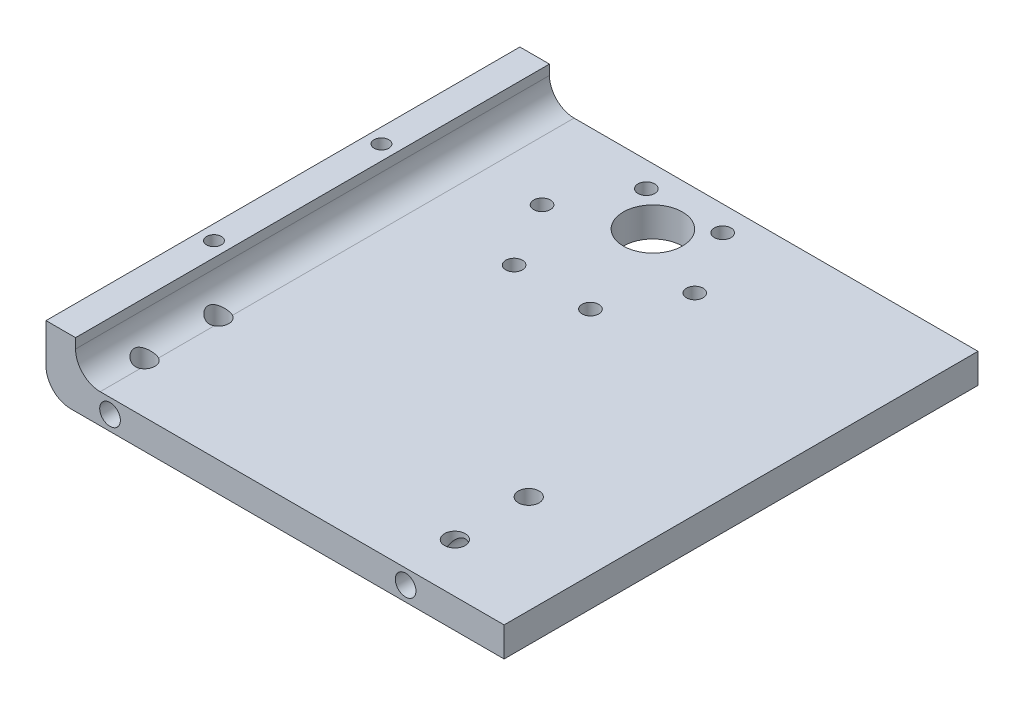
from build123d import *

# Parameters (mm, degrees)
SKETCH1_W           = 93
SKETCH1_H           = 96.2019
SKETCH1_R           = 6
SKETCH1_R_2         = 1.7
SKETCH1_R_3         = 2.1
BOSS_EXTRUDE1_DEPTH = 6
BOSS_EXTRUDE2_START = -6
SKETCH2_W           = 6
SKETCH2_H           = 96.2019
SKETCH2_R           = 1.5
BOSS_EXTRUDE2_DEPTH = 7
SKETCH2_3_R         = 1.5
CUT_EXTRUDE2_DEPTH  = 135.435135153
SKETCH3_R           = 2.1
CUT_EXTRUDE3_DEPTH  = 18
CUT_EXTRUDE4_START  = -78.2019
SKETCH3_2_R         = 2.1
CUT_EXTRUDE4_DEPTH  = 18
FILLET1_R           = 5


with BuildPart() as part:
    # Sketch1 → Boss-Extrude1 (new body)
    with BuildSketch(Plane(origin=(0, 0, 0), x_dir=(-1, 0, 0), z_dir=(0, 1, 0))):
        with Locations((46.5, 48.10095)):
            Rectangle(SKETCH1_W, SKETCH1_H)
        with Locations(Location((54.5, 11.5, 0), (0, 0, 90))):
            Circle(SKETCH1_R, mode=Mode.SUBTRACT)
        with Locations(Location((39, 18.5, 0), (0, 0, 90))):
            Circle(SKETCH1_R_2, mode=Mode.SUBTRACT)
        with Locations(Location((46.75, 31.923393759, 0), (0, 0, 90))):
            Circle(SKETCH1_R_2, mode=Mode.SUBTRACT)
        with Locations(Location((62.25, 31.923393759, 0), (0, 0, 90))):
            Circle(SKETCH1_R_2, mode=Mode.SUBTRACT)
        with Locations(Location((70, 18.5, 0), (0, 0, 90))):
            Circle(SKETCH1_R_2, mode=Mode.SUBTRACT)
        with Locations(Location((62.25, 5.076606241, 0), (0, 0, 90))):
            Circle(SKETCH1_R_2, mode=Mode.SUBTRACT)
        with Locations(Location((46.75, 5.076606241, 0), (0, 0, 90))):
            Circle(SKETCH1_R_2, mode=Mode.SUBTRACT)
        with Locations(Location((20, 86.2019, 0), (0, 0, 90))):
            Circle(SKETCH1_R_3, mode=Mode.SUBTRACT)
        with Locations(Location((83, 86.2019, 0), (0, 0, 90))):
            Circle(SKETCH1_R_3, mode=Mode.SUBTRACT)
        with Locations(Location((83, 71.2019, 0), (0, 0, 90))):
            Circle(SKETCH1_R_3, mode=Mode.SUBTRACT)
        with Locations(Location((20, 71.2019, 0), (0, 0, 90))):
            Circle(SKETCH1_R_3, mode=Mode.SUBTRACT)
    extrude(amount=BOSS_EXTRUDE1_DEPTH)

    # Sketch2 → Boss-Extrude2 (add)
    with BuildSketch(Plane(origin=(0, 0, 0), x_dir=(-1, 0, 0), z_dir=(0, -1, 0)).offset(BOSS_EXTRUDE2_START)):
        with Locations((90, -48.10095)):
            Rectangle(SKETCH2_W, SKETCH2_H)
        with Locations(Location((90, -65.10095, 0), (0, 0, 90))):
            Circle(SKETCH2_R, mode=Mode.SUBTRACT)
        with Locations(Location((90, -31.10095, 0), (0, 0, 90))):
            Circle(SKETCH2_R, mode=Mode.SUBTRACT)
    extrude(amount=-BOSS_EXTRUDE2_DEPTH)

    # Sketch2<3> → Cut-Extrude2 (cut, through all)
    with BuildSketch(Plane(origin=(0, 0, 0), x_dir=(-1, 0, 0), z_dir=(0, -1, 0))):
        with Locations(Location((90, -31.10095, 0), (0, 0, 90))):
            Circle(SKETCH2_3_R)
        with Locations(Location((90, -65.10095, 0), (0, 0, 90))):
            Circle(SKETCH2_3_R)
    extrude(amount=-CUT_EXTRUDE2_DEPTH, mode=Mode.SUBTRACT)

    # Sketch3 → Cut-Extrude3 (cut)
    with BuildSketch(Plane(origin=(0, 0, 0), x_dir=(1, 0, 0), z_dir=(0, 0, -1))):
        with Locations(Location((-80, -3, 0), (0, 0, 180))):
            Circle(SKETCH3_R)
        with Locations(Location((-20, -3, 0), (0, 0, 180))):
            Circle(SKETCH3_R)
    extrude(amount=-CUT_EXTRUDE3_DEPTH, mode=Mode.SUBTRACT)

    # Sketch3<2> → Cut-Extrude4 (cut)
    with BuildSketch(Plane(origin=(0, 0, 0), x_dir=(1, 0, 0), z_dir=(0, 0, -1)).offset(CUT_EXTRUDE4_START)):
        with Locations(Location((-80, -3, 0), (0, 0, 180))):
            Circle(SKETCH3_2_R)
        with Locations(Location((-20, -3, 0), (0, 0, 180))):
            Circle(SKETCH3_2_R)
    extrude(amount=-CUT_EXTRUDE4_DEPTH, mode=Mode.SUBTRACT)

    # Fillet1
    # the kernel refuses this fillet: 5 mm, written as the material it adds along each edge
    with BuildSketch(Plane(origin=(-87, 6, 96.2019), x_dir=(1, 0, 0), z_dir=(0, 0, -1))) as fillet1_piece_1_section:
        with BuildLine():
            CenterArc((FILLET1_R, -FILLET1_R), FILLET1_R, 90, 90)
            Line((0, -FILLET1_R), (0, 0))
            Line((0, 0), (FILLET1_R, 0))
        make_face()
    fillet1_piece_1 = extrude(amount=96.2019, mode=Mode.PRIVATE)
    fillet1_piece_1 = fillet1_piece_1 - Plane(origin=(-83, 7.144811059, 71.2019), x_dir=(0, 0, 1), z_dir=(0, -1, 0)) * Cylinder(2.1, 213, mode=Mode.PRIVATE)
    fillet1_piece_1 = fillet1_piece_1 - Plane(origin=(-83, 7.144811059, 86.2019), x_dir=(0, 0, 1), z_dir=(0, -1, 0)) * Cylinder(2.1, 213, mode=Mode.PRIVATE)
    add(fillet1_piece_1)
    # the kernel refuses this fillet: 5 mm, written as the material it takes off along each edge
    with BuildSketch(Plane(origin=(-93, 0, -12.5), x_dir=(1, 0, 0), z_dir=(0, 0, 1))) as fillet1_2_piece_1:
        with BuildLine():
            CenterArc((FILLET1_R, FILLET1_R), FILLET1_R, 180, 90)
            Line((0, FILLET1_R), (0, 0))
            Line((0, 0), (FILLET1_R, 0))
        make_face()
    extrude(amount=121.2019, mode=Mode.SUBTRACT)


solid = part.part
